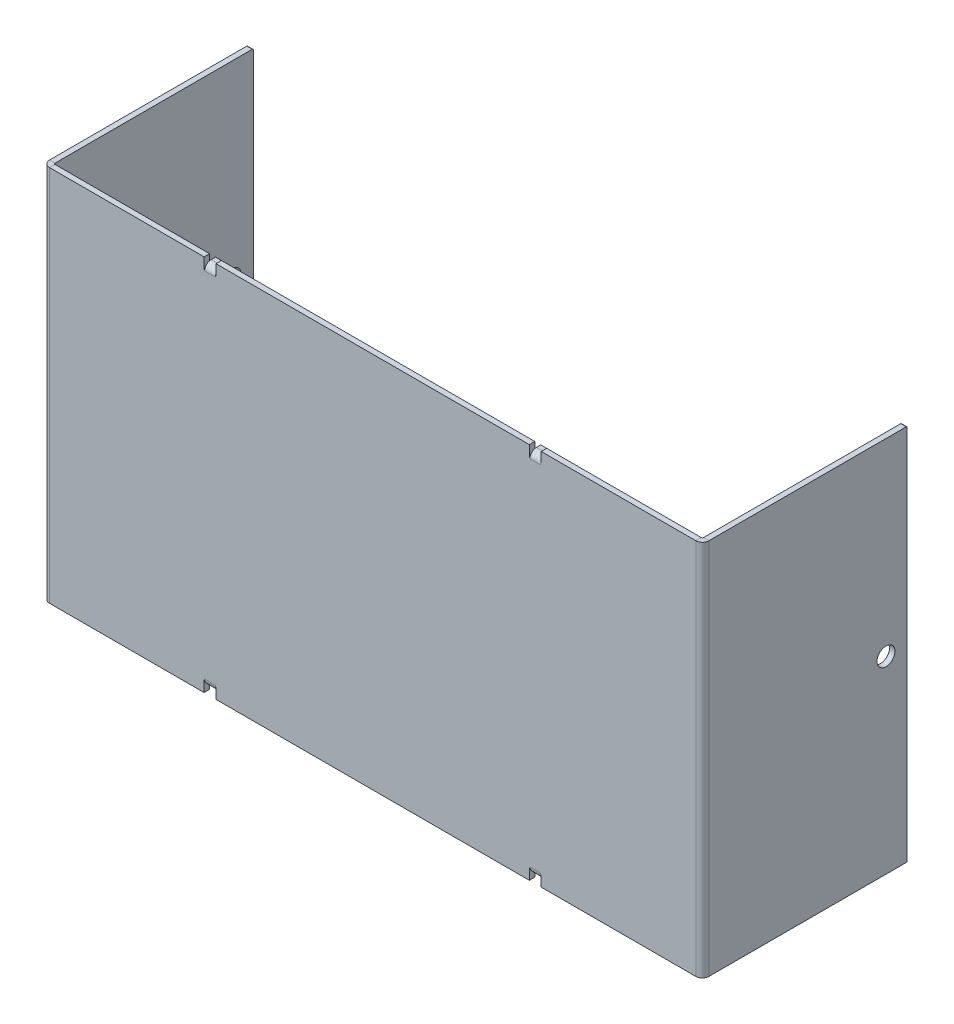
from build123d import *

# Parameters (mm, degrees)
SKETCH1_W                         = 152.4
SKETCH1_H                         = 88.9
BASE_FLANGE1_DEPTH                = 1.29032
EDGE_FLANGE1_STRIP_W              = 5.85978
EDGE_FLANGE1_STRIP_H              = 1.29032
EDGE_FLANGE1_STRIP_CUT_DEPTH      = 88.9
EDGE_FLANGE1_STRIP_2_W            = 5.85978
EDGE_FLANGE1_STRIP_2_H            = 1.29032
EDGE_FLANGE1_STRIP_CUT_2_DEPTH    = 88.9
EDGE_FLANGE1_DEPTH                = 88.9
EDGE_FLANGE1_BEND_DEPTH           = 88.9
F_4_22MM_HOLE_FOR_M3_CLINCH_NUT_D = 4.22
BREAK_CORNER1_START               = -77.68082
BREAK_CORNER1_DEPTH               = 155.36164
CUT_THICKEN1_START                = 41.91
CUT_THICKEN1_OUTLINE_W            = 0.127
CUT_THICKEN1_OUTLINE_H            = 1.29032
CUT_THICKEN1_DEPTH                = 2.54
CUT_THICKEN2_START                = 41.91
CUT_THICKEN2_OUTLINE_W            = 0.127
CUT_THICKEN2_OUTLINE_H            = 1.29032
CUT_THICKEN2_DEPTH                = 2.54
MIRROR7_START                     = 41.91
MIRROR7_COPY_1_SKETCH_W           = 0.127
MIRROR7_COPY_1_SKETCH_H           = 1.29032
MIRROR7_COPY_1_DEPTH              = 2.54
MIRROR7_COPY_2_SKETCH_W           = 0.127
MIRROR7_COPY_2_SKETCH_H           = 1.29032
MIRROR7_COPY_2_DEPTH              = 2.54
MOVE_FACE1_BY                     = 1.27
MOVE_FACE1_2_BY                   = 1.27
MOVE_FACE1_3_BY                   = 1.27
MOVE_FACE1_4_BY                   = 1.27
EDGE_FLANGE2_STRIP_W              = 5.66928
EDGE_FLANGE2_STRIP_H              = 1.29032
EDGE_FLANGE2_STRIP_CUT_DEPTH      = 2.54
EDGE_FLANGE2_STRIP_2_W            = 5.66928
EDGE_FLANGE2_STRIP_2_H            = 1.29032
EDGE_FLANGE2_STRIP_CUT_2_DEPTH    = 2.54
EDGE_FLANGE2_STRIP_3_W            = 5.66928
EDGE_FLANGE2_STRIP_3_H            = 1.29032
EDGE_FLANGE2_STRIP_CUT_3_DEPTH    = 2.54
EDGE_FLANGE2_STRIP_4_W            = 5.66928
EDGE_FLANGE2_STRIP_4_H            = 1.29032
EDGE_FLANGE2_STRIP_CUT_4_DEPTH    = 2.54
EDGE_FLANGE2_DEPTH                = 2.54
EDGE_FLANGE2_BEND_DEPTH           = 2.54
EDGE_FLANGE2_BEND_2_DEPTH         = 2.54
EDGE_FLANGE2_BEND_3_DEPTH         = 2.54


# Read off the part's stored shape, not the designer's step: Break-Corner1, Cut-Thicken1, Cut-Thicken2
# Sheet-metal steps are written as plain solids
with BuildPart() as part:
    # Sketch1 → Base-Flange1 (new body)
    with BuildSketch(Plane.XY):
        Rectangle(SKETCH1_W, SKETCH1_H)
    extrude(amount=-BASE_FLANGE1_DEPTH)

    # Edge-Flange1 strip (across the edge) → Edge-Flange1 strip cut (cut)
    with BuildSketch(Plane(origin=(-76.3905, -44.45, -1.29032), x_dir=(1, 0, 0), z_dir=(0, 1, 0))):
        with Locations((-2.67589, -0.64516)):
            Rectangle(EDGE_FLANGE1_STRIP_W, EDGE_FLANGE1_STRIP_H)
    extrude(amount=EDGE_FLANGE1_STRIP_CUT_DEPTH, mode=Mode.SUBTRACT)

    # Edge-Flange1 strip 2 (across the edge) → Edge-Flange1 strip cut 2 (cut)
    with BuildSketch(Plane(origin=(76.3905, 44.45, -1.29032), x_dir=(-1, 0, 0), z_dir=(0, -1, 0))):
        with Locations((-2.67589, -0.64516)):
            Rectangle(EDGE_FLANGE1_STRIP_2_W, EDGE_FLANGE1_STRIP_2_H)
    extrude(amount=EDGE_FLANGE1_STRIP_CUT_2_DEPTH, mode=Mode.SUBTRACT)

    # Edge-Flange1 section (across the edge) → Edge-Flange1 (add)
    with BuildSketch(Plane(origin=(-76.3905, -44.45, -1.29032), x_dir=(1, 0, 0), z_dir=(0, 1, 0))):
        with BuildLine():
            Line((-1.29032, 0.254), (-1.29032, 46.96968))
            Line((-1.29032, 46.96968), (0, 46.96968))
            Line((0, 46.96968), (0, 0.254))
            ThreePointArc((0, 0.254), (0.074394878, 0.074394878), (0.254, 0))
            Line((0.254, 0), (0.254, -1.29032))
            ThreePointArc((0.254, -1.29032), (-0.837999144, -0.837999144), (-1.29032, 0.254))
        make_face()
    extrude(amount=EDGE_FLANGE1_DEPTH)

    # Edge-Flange1 section 2 (across the edge) → Edge-Flange1 bend (add)
    with BuildSketch(Plane(origin=(76.3905, 44.45, -1.29032), x_dir=(-1, 0, 0), z_dir=(0, -1, 0))):
        with BuildLine():
            Line((-1.29032, 0.254), (-1.29032, 46.96968))
            Line((-1.29032, 46.96968), (0, 46.96968))
            Line((0, 46.96968), (0, 0.254))
            ThreePointArc((0, 0.254), (0.074394878, 0.074394878), (0.254, 0))
            Line((0.254, 0), (0.254, -1.29032))
            ThreePointArc((0.254, -1.29032), (-0.837999144, -0.837999144), (-1.29032, 0.254))
        make_face()
    extrude(amount=EDGE_FLANGE1_BEND_DEPTH)

    # Ø4.22mm hole for M3 Clinch nut (through all)
    with Locations(Plane.ZY.offset(77.68082)):
        with Locations((-43.26, 0)):
            f_4_22mm_hole_for_m3_clinch_nut = Hole(F_4_22MM_HOLE_FOR_M3_CLINCH_NUT_D / 2)

    # Mirror1: Ø4.22mm hole for M3 Clinch nut across plane
    add(f_4_22mm_hole_for_m3_clinch_nut.mirror(Plane(origin=(0, 0, 0), x_dir=(0, 0, 1), z_dir=(1, 0, 0))), mode=Mode.SUBTRACT)

    # Break-Corner1 outline → Break-Corner1 (cut)
    with BuildSketch(Plane.YZ.offset(BREAK_CORNER1_START)):
        with BuildLine():
            Line((44.45, -48.26), (44.45, -48.006))
            ThreePointArc((44.45, -48.006), (44.375605122, -48.185605122), (44.196, -48.26))
            Line((44.196, -48.26), (44.45, -48.26))
        make_face()
        with BuildLine():
            Line((-44.45, -48.26), (-44.196, -48.26))
            ThreePointArc((-44.196, -48.26), (-44.375605122, -48.185605122), (-44.45, -48.006))
            Line((-44.45, -48.006), (-44.45, -48.26))
        make_face()
    extrude(amount=BREAK_CORNER1_DEPTH, mode=Mode.SUBTRACT)

    # Cut-Thicken1 outline → Cut-Thicken1 (cut)
    with BuildSketch(Plane(origin=(0, 0, 0), x_dir=(1, 0, 0), z_dir=(0, 1, 0)).offset(CUT_THICKEN1_START)):
        with Locations((36.97732, 0.64516)):
            Rectangle(CUT_THICKEN1_OUTLINE_W, CUT_THICKEN1_OUTLINE_H)
    cut_thicken1 = extrude(amount=CUT_THICKEN1_DEPTH, mode=Mode.SUBTRACT)

    # Cut-Thicken2 outline → Cut-Thicken2 (cut)
    with BuildSketch(Plane(origin=(0, 0, 0), x_dir=(1, 0, 0), z_dir=(0, 1, 0)).offset(CUT_THICKEN2_START)):
        with Locations((39.64432, 0.64516)):
            Rectangle(CUT_THICKEN2_OUTLINE_W, CUT_THICKEN2_OUTLINE_H)
    cut_thicken2 = extrude(amount=CUT_THICKEN2_DEPTH, mode=Mode.SUBTRACT)

    # Mirror6: Cut-Thicken1, Cut-Thicken2 across plane
    add(cut_thicken1.mirror(Plane(origin=(0, 0, 0), x_dir=(0, 0, 1), z_dir=(1, 0, 0))), mode=Mode.SUBTRACT)
    add(cut_thicken2.mirror(Plane(origin=(0, 0, 0), x_dir=(0, 0, 1), z_dir=(1, 0, 0))), mode=Mode.SUBTRACT)

    # Mirror7: Cut-Thicken1, Cut-Thicken2 across plane
    add(cut_thicken1.mirror(Plane.ZX), mode=Mode.SUBTRACT)
    add(cut_thicken2.mirror(Plane.ZX), mode=Mode.SUBTRACT)

    # Mirror7 copy 1 sketch → Mirror7 copy 1 (cut)
    with BuildSketch(Plane(origin=(0, 0, 0), x_dir=(-1, 0, 0), z_dir=(0, -1, 0)).offset(MIRROR7_START)):
        with Locations((36.97732, 0.64516)):
            Rectangle(MIRROR7_COPY_1_SKETCH_W, MIRROR7_COPY_1_SKETCH_H)
    extrude(amount=MIRROR7_COPY_1_DEPTH, mode=Mode.SUBTRACT)

    # Mirror7 copy 2 sketch → Mirror7 copy 2 (cut)
    with BuildSketch(Plane(origin=(0, 0, 0), x_dir=(-1, 0, 0), z_dir=(0, -1, 0)).offset(MIRROR7_START)):
        with Locations((39.64432, 0.64516)):
            Rectangle(MIRROR7_COPY_2_SKETCH_W, MIRROR7_COPY_2_SKETCH_H)
    extrude(amount=MIRROR7_COPY_2_DEPTH, mode=Mode.SUBTRACT)

    # Move Face1: a face moved inward by 1.27
    extrude(part.faces().sort_by_distance((-38.31082, -44.45, -0.64516))[0], amount=MOVE_FACE1_BY, dir=(0, 1, 0), mode=Mode.SUBTRACT)

    # Move Face1 2: a face moved inward by 1.27
    extrude(part.faces().sort_by_distance((38.31082, -44.45, -0.64516))[0], amount=MOVE_FACE1_2_BY, dir=(0, 1, 0), mode=Mode.SUBTRACT)

    # Move Face1 3: a face moved inward by 1.27
    extrude(part.faces().sort_by_distance((-38.31082, 44.45, -0.64516))[0], amount=MOVE_FACE1_3_BY, dir=(0, -1, 0), mode=Mode.SUBTRACT)

    # Move Face1 4: a face moved inward by 1.27
    extrude(part.faces().sort_by_distance((38.31082, 44.45, -0.64516))[0], amount=MOVE_FACE1_4_BY, dir=(0, -1, 0), mode=Mode.SUBTRACT)

    # Edge-Flange2 strip (across the edge) → Edge-Flange2 strip cut (cut)
    with BuildSketch(Plane(origin=(37.04082, 43.18, -1.29032), x_dir=(0, -1, 0), z_dir=(1, 0, 0))):
        with Locations((-1.29032, -0.64516)):
            Rectangle(EDGE_FLANGE2_STRIP_W, EDGE_FLANGE2_STRIP_H)
    extrude(amount=EDGE_FLANGE2_STRIP_CUT_DEPTH, mode=Mode.SUBTRACT)

    # Edge-Flange2 strip 2 (across the edge) → Edge-Flange2 strip cut 2 (cut)
    with BuildSketch(Plane(origin=(-39.58082, 43.18, -1.29032), x_dir=(0, -1, 0), z_dir=(1, 0, 0))):
        with Locations((-1.29032, -0.64516)):
            Rectangle(EDGE_FLANGE2_STRIP_2_W, EDGE_FLANGE2_STRIP_2_H)
    extrude(amount=EDGE_FLANGE2_STRIP_CUT_2_DEPTH, mode=Mode.SUBTRACT)

    # Edge-Flange2 strip 3 (across the edge) → Edge-Flange2 strip cut 3 (cut)
    with BuildSketch(Plane(origin=(39.58082, -43.18, -1.29032), x_dir=(0, 1, 0), z_dir=(-1, 0, 0))):
        with Locations((-1.29032, -0.64516)):
            Rectangle(EDGE_FLANGE2_STRIP_3_W, EDGE_FLANGE2_STRIP_3_H)
    extrude(amount=EDGE_FLANGE2_STRIP_CUT_3_DEPTH, mode=Mode.SUBTRACT)

    # Edge-Flange2 strip 4 (across the edge) → Edge-Flange2 strip cut 4 (cut)
    with BuildSketch(Plane(origin=(-37.04082, -43.18, -1.29032), x_dir=(0, 1, 0), z_dir=(-1, 0, 0))):
        with Locations((-1.29032, -0.64516)):
            Rectangle(EDGE_FLANGE2_STRIP_4_W, EDGE_FLANGE2_STRIP_4_H)
    extrude(amount=EDGE_FLANGE2_STRIP_CUT_4_DEPTH, mode=Mode.SUBTRACT)

    # Edge-Flange2 section (across the edge) → Edge-Flange2 (add)
    with BuildSketch(Plane(origin=(37.04082, 43.18, -1.29032), x_dir=(0, -1, 0), z_dir=(1, 0, 0))):
        with BuildLine():
            Line((0, 0.254), (0, 1.27))
            Line((0, 1.27), (1.29032, 1.27))
            Line((1.29032, 1.27), (1.29032, 0.254))
            ThreePointArc((1.29032, 0.254), (1.364714878, 0.074394878), (1.54432, 0))
            Line((1.54432, 0), (1.54432, -1.29032))
            ThreePointArc((1.54432, -1.29032), (0.452320856, -0.837999144), (0, 0.254))
        make_face()
    extrude(amount=EDGE_FLANGE2_DEPTH)

    # Edge-Flange2 section 2 (across the edge) → Edge-Flange2 bend (add)
    with BuildSketch(Plane(origin=(-39.58082, 43.18, -1.29032), x_dir=(0, -1, 0), z_dir=(1, 0, 0))):
        with BuildLine():
            Line((0, 0.254), (0, 1.27))
            Line((0, 1.27), (1.29032, 1.27))
            Line((1.29032, 1.27), (1.29032, 0.254))
            ThreePointArc((1.29032, 0.254), (1.364714878, 0.074394878), (1.54432, 0))
            Line((1.54432, 0), (1.54432, -1.29032))
            ThreePointArc((1.54432, -1.29032), (0.452320856, -0.837999144), (0, 0.254))
        make_face()
    extrude(amount=EDGE_FLANGE2_BEND_DEPTH)

    # Edge-Flange2 section 3 (across the edge) → Edge-Flange2 bend 2 (add)
    with BuildSketch(Plane(origin=(39.58082, -43.18, -1.29032), x_dir=(0, 1, 0), z_dir=(-1, 0, 0))):
        with BuildLine():
            Line((0, 0.254), (0, 1.27))
            Line((0, 1.27), (1.29032, 1.27))
            Line((1.29032, 1.27), (1.29032, 0.254))
            ThreePointArc((1.29032, 0.254), (1.364714878, 0.074394878), (1.54432, 0))
            Line((1.54432, 0), (1.54432, -1.29032))
            ThreePointArc((1.54432, -1.29032), (0.452320856, -0.837999144), (0, 0.254))
        make_face()
    extrude(amount=EDGE_FLANGE2_BEND_2_DEPTH)

    # Edge-Flange2 section 4 (across the edge) → Edge-Flange2 bend 3 (add)
    with BuildSketch(Plane(origin=(-37.04082, -43.18, -1.29032), x_dir=(0, 1, 0), z_dir=(-1, 0, 0))):
        with BuildLine():
            Line((0, 0.254), (0, 1.27))
            Line((0, 1.27), (1.29032, 1.27))
            Line((1.29032, 1.27), (1.29032, 0.254))
            ThreePointArc((1.29032, 0.254), (1.364714878, 0.074394878), (1.54432, 0))
            Line((1.54432, 0), (1.54432, -1.29032))
            ThreePointArc((1.54432, -1.29032), (0.452320856, -0.837999144), (0, 0.254))
        make_face()
    extrude(amount=EDGE_FLANGE2_BEND_3_DEPTH)


solid = part.part
